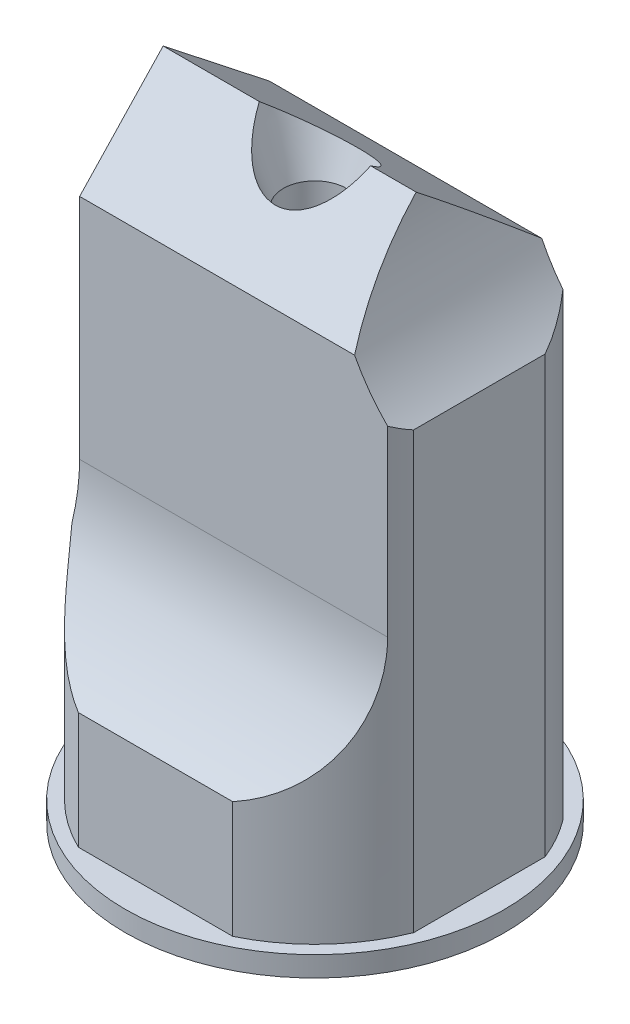
from build123d import *

# Parameters (mm, degrees)
ESBO_O1_R                = 7.5
ESBO_O1_R_2              = 1.25
RESSALTO_EXTRUS_O1_DEPTH = 23.6
CORTE_EXTRUS_O1_START    = -22.8
ESBO_O2_R                = 7.5
CORTE_EXTRUS_O1_DEPTH    = 22.8
CORTE_EXTRUS_O2_DEPTH    = 29.446616671
ESBO_O4_R                = 3.5
ESBO_O4_R_2              = 2.5
ESBO_O4_R_3              = 1.25
CORTE_EXTRUS_O3_DEPTH    = 4
ESBO_O4_3_R              = 2.5
ESBO_O4_3_R_2            = 1.25
CORTE_EXTRUS_O4_DEPTH    = 20
ESBO_O5_R                = 2.2
ESBO_O6_R                = 1.25
ESBO_O7_R                = 7.5
CORTE_EXTRUS_O5_DEPTH    = 28.015736242
CHANFRO1_SIZE            = 2


with BuildPart() as part:
    # Esboço1 → Ressalto-extrusão1 (new body)
    with BuildSketch(Plane(origin=(0, 0, 0), x_dir=(1, 0, 0), z_dir=(0, 1, 0))):
        with Locations(Location((0, 0, 0), (0, 0, 270))):
            Circle(ESBO_O1_R)
        with Locations(Location((0, 0, 0), (0, 0, 270))):
            Circle(ESBO_O1_R_2, mode=Mode.SUBTRACT)
    extrude(amount=RESSALTO_EXTRUS_O1_DEPTH)

    # Esboço2 → Corte-extrusão1 (cut)
    with BuildSketch(Plane(origin=(0, 23.6, 0), x_dir=(1, 0, 0), z_dir=(0, 1, 0)).offset(CORTE_EXTRUS_O1_START)):
        with Locations(Location((0, 0, 0), (0, 0, 270))):
            Circle(ESBO_O2_R)
        with BuildLine():
            ThreePointArc((-6, -3.605551275), (-4.721885351, -5.167571841), (-3.05122926, -6.3))
            Line((-3.05122926, -6.3), (3.05122926, -6.3))
            ThreePointArc((3.05122926, -6.3), (5.121772645, -4.771524386), (6.5, -2.598076211))
            Line((6.5, -2.598076211), (6.5, 2.598076211))
            ThreePointArc((6.5, 2.598076211), (6.102789523, 3.428696552), (5.6, 4.2))
            Line((5.6, 4.2), (-6, 4.2))
            Line((-6, 4.2), (-6, -3.605551275))
        make_face(mode=Mode.SUBTRACT)
    extrude(amount=CORTE_EXTRUS_O1_DEPTH, mode=Mode.SUBTRACT)

    # Esboço3 → Corte-extrusão2 (cut, through all)
    with BuildSketch(Plane(origin=(6.5, 0, 0), x_dir=(0, 0, -1), z_dir=(1, 0, 0))):
        with BuildLine():
            Line((-6.3, 0.8), (-6.3, 5.41))
            ThreePointArc((-6.3, 5.41), (-4.095903015, 7.8849582), (-3.3, 11.102099788))
            Line((-3.3, 11.102099788), (-3.3, 20.102099788))
            Line((-3.3, 20.102099788), (0, 23.6))
            Line((0, 23.6), (4.2, 20.3))
            Line((4.2, 20.3), (4.2, 26.498132866))
            Line((4.2, 26.498132866), (-7.5, 26.498132866))
            Line((-7.5, 26.498132866), (-7.5, 0.8))
            Line((-7.5, 0.8), (-6.3, 0.8))
        make_face()
    extrude(amount=-CORTE_EXTRUS_O2_DEPTH, mode=Mode.SUBTRACT)

    # Esboço4 → Corte-extrusão3 (cut)
    # profile 1 of 2: a face of its own
    with BuildSketch(Plane.XZ):
        with Locations(Location((0, 0, 0), (0, 0, 270))):
            Circle(ESBO_O4_R)
        Circle(ESBO_O4_R_2, mode=Mode.SUBTRACT)
    # profile 2 of 2: a face of its own
    with BuildSketch(Plane.XZ):
        Circle(ESBO_O4_R_2)
        with Locations(Location((0, 0, 0), (0, 0, 270))):
            Circle(ESBO_O4_R_3, mode=Mode.SUBTRACT)
    extrude(amount=-CORTE_EXTRUS_O3_DEPTH, mode=Mode.SUBTRACT)

    # Esboço4<3> → Corte-extrusão4 (cut)
    with BuildSketch(Plane.XZ):
        with Locations(Location((0, 0, 0), (0, 0, 270))):
            Circle(ESBO_O4_3_R)
        with Locations(Location((0, 0, 0), (0, 0, 270))):
            Circle(ESBO_O4_3_R_2, mode=Mode.SUBTRACT)
    extrude(amount=-CORTE_EXTRUS_O4_DEPTH, mode=Mode.SUBTRACT)

    # Esboço5 → Loft de corte1 section 0
    with BuildSketch(Plane(origin=(0, 23.6, 0), x_dir=(1, 0, 0), z_dir=(0, 1, 0))):
        Circle(ESBO_O5_R)
    # Esboço6 → Loft de corte1 section 1
    with BuildSketch(Plane(origin=(0, 21.1, 0), x_dir=(-1, 0, 0), z_dir=(0, -1, 0))):
        Circle(ESBO_O6_R)
    loft(mode=Mode.SUBTRACT)

    # Esboço7 → Corte-extrusão5 (cut, through all)
    with BuildSketch(Plane.XY.offset(3.3)):
        with Locations((11.5, 23.6)):
            Circle(ESBO_O7_R)
    extrude(amount=-CORTE_EXTRUS_O5_DEPTH, mode=Mode.SUBTRACT)

    # Chanfro1
    # the kernel refuses this chamfer: 2 mm, written as the material it takes off along each edge
    with BuildSketch(Plane(origin=(0, 4, 0), x_dir=(0, 0, -1), z_dir=(-1, 0, 0))) as chanfro1_piece_1_section:
        Polygon((2.5 + CHANFRO1_SIZE, 0), (2.5, -CHANFRO1_SIZE), (2.5, 0), align=None)
    chanfro1_piece_1 = revolve(axis=Axis((0, 4, 0), (0, -1, 0)), mode=Mode.PRIVATE)
    chanfro1_piece_1 = chanfro1_piece_1 & Plane(origin=(0, 5.506317811, 0), x_dir=(0, 0, -1), z_dir=(0, -1, 0)) * Cylinder(3.5, 18, mode=Mode.PRIVATE)
    add(chanfro1_piece_1, mode=Mode.SUBTRACT)


solid = part.part
